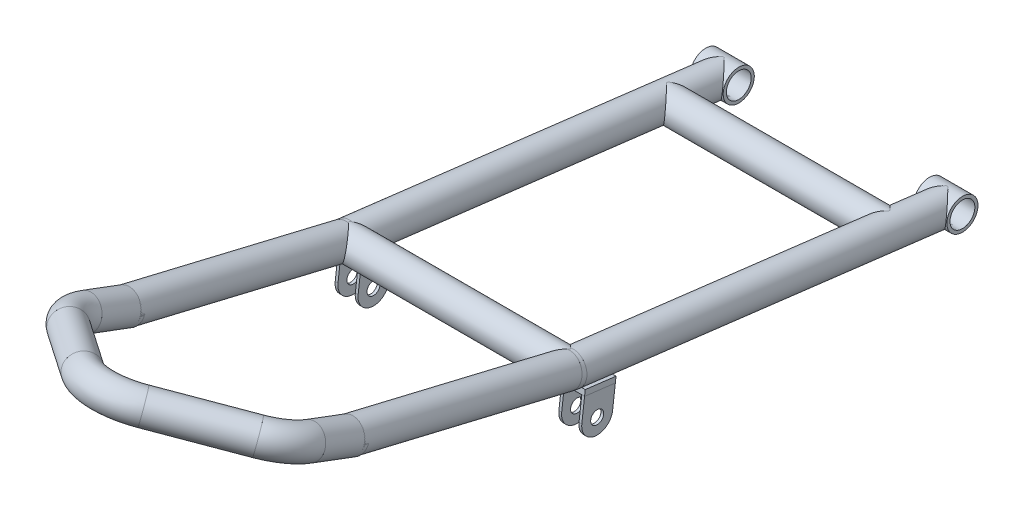
from build123d import *

# Parameters (mm, degrees)
CROQUIS2_R                       = 16.7
CROQUIS2_R_2                     = 13.32
SALIENTE_EXTRUIR3_DEPTH          = 17.7
MATRIZL2_COUNT                   = 2
MATRIZL2_PITCH                   = 240
SALIENTE_EXTRUIR5_DEPTH          = 24.6
SKETCH11_R                       = 16.7005
SKETCH11_R_2                     = 13.3223
MIEMBRO_ESTRUCTURAL3_DEPTH       = 240
SKETCH13_R                       = 16.7005
SKETCH13_R_2                     = 13.3223
MIEMBRO_ESTRUCTURAL5_DEPTH       = 240
SKETCH1_R                        = 16.7005
SKETCH1_R_2                      = 13.3223
MIEMBRO_ESTRUCTURAL8_DEPTH       = 240
SKETCH1_ON_SEGMENT_2_R           = 16.7005
SKETCH1_ON_SEGMENT_2_R_2         = 13.3223
MIEMBRO_ESTRUCTURAL8_2_DEPTH     = 405
SKETCH1_ON_SEGMENT_3_R           = 16.7005
SKETCH1_ON_SEGMENT_3_R_2         = 13.3223
MIEMBRO_ESTRUCTURAL8_3_DEPTH     = 50
SKETCH1_ON_SEGMENT_4_R           = 16.7005
SKETCH1_ON_SEGMENT_4_R_2         = 13.3223
MIEMBRO_ESTRUCTURAL8_4_ANGLE     = 50.254216628
SKETCH1_ON_SEGMENT_5_R           = 16.7005
SKETCH1_ON_SEGMENT_5_R_2         = 13.3223
MIEMBRO_ESTRUCTURAL8_5_DEPTH     = 90
SKETCH1_ON_SEGMENT_6_R           = 16.7005
SKETCH1_ON_SEGMENT_6_R_2         = 13.3223
MIEMBRO_ESTRUCTURAL8_6_ANGLE     = 79.491566745
SKETCH1_ON_SEGMENT_7_R           = 16.7005
SKETCH1_ON_SEGMENT_7_R_2         = 13.3223
MIEMBRO_ESTRUCTURAL8_7_DEPTH     = 90
SKETCH1_ON_SEGMENT_8_R           = 16.7005
SKETCH1_ON_SEGMENT_8_R_2         = 13.3223
MIEMBRO_ESTRUCTURAL8_8_ANGLE     = 50.254216628
SKETCH1_ON_SEGMENT_9_R           = 16.7005
SKETCH1_ON_SEGMENT_9_R_2         = 13.3223
MIEMBRO_ESTRUCTURAL8_9_DEPTH     = 50
MIEMBRO_ESTRUCTURAL9_OUTLINE_R   = 16.7005
MIEMBRO_ESTRUCTURAL9_OUTLINE_R_2 = 13.3223
MIEMBRO_ESTRUCTURAL9_ANGLE       = 6.420984
CORTAR_EXTRUIR1_START            = -310
CROQUIS25_R                      = 13.32
CORTAR_EXTRUIR1_DEPTH            = 310
CROQUIS10_R                      = 7
SALIENTE_EXTRUIR6_DEPTH          = 3


# Read off the part's stored shape, not the designer's step: Miembro estructural9
with BuildPart() as part:
    # Croquis2 → Saliente-Extruir3 (new, symmetric)
    with BuildSketch(Plane(origin=(120, 0, 0), x_dir=(0, 0, -1), z_dir=(1, 0, 0))):
        Circle(CROQUIS2_R)
        Circle(CROQUIS2_R_2, mode=Mode.SUBTRACT)
    saliente_extruir3 = extrude(amount=SALIENTE_EXTRUIR3_DEPTH, both=True)


with BuildPart() as matrizl2_1:
    # MatrizL2: Saliente-Extruir3 ×2
    with Locations(*[(-i * MATRIZL2_PITCH, 0, 0) for i in range(1, MATRIZL2_COUNT)]):
        add(saliente_extruir3)


with BuildPart() as body_3:
    # Croquis11 → Saliente-Extruir5 (new body)
    with BuildSketch(Plane(origin=(132.3, 0, 0), x_dir=(0, 0, -1), z_dir=(1, 0, 0))):
        Polygon((-400.007551389, 28.138933971), (-399.276335328, 34.094210881), (-366.25408611, 30.03958851), (-366.985302171, 24.084311601), align=None)
    extrude(amount=-SALIENTE_EXTRUIR5_DEPTH)


with BuildPart() as body_4:
    # Sketch11 → Miembro estructural3 (new body)
    with BuildSketch(Plane(origin=(120, 7.593004429, 61.840053094), x_dir=(0, 0.12186934340514761, 0.9925461516413221), z_dir=(-1.0, -5.447984185373814e-09, 6.689284625238227e-10))):
        Circle(SKETCH11_R)
        Circle(SKETCH11_R_2, mode=Mode.SUBTRACT)
    extrude(amount=MIEMBRO_ESTRUCTURAL3_DEPTH)


with BuildPart() as body_5:
    # Sketch13 → Miembro estructural5 (new body)
    with BuildSketch(Plane(origin=(-120, 49.704349846, 404.809444122), x_dir=(0, 0.2419218955996682, 0.9702957262759964), z_dir=(1, 0, 0))):
        Circle(SKETCH13_R)
        Circle(SKETCH13_R_2, mode=Mode.SUBTRACT)
    extrude(amount=MIEMBRO_ESTRUCTURAL5_DEPTH)


with BuildPart() as body_6:
    # Sketch1 → Miembro estructural8 (new body)
    with BuildSketch(Plane(origin=(120, 106.070724678, 641.026945046), x_dir=(0, 0.9726909395542314, -0.23210414927162898), z_dir=(0, -0.23210414927162898, -0.9726909395542314))):
        Circle(SKETCH1_R)
        Circle(SKETCH1_R_2, mode=Mode.SUBTRACT)
    extrude(amount=MIEMBRO_ESTRUCTURAL8_DEPTH)


with BuildPart() as body_7:
    # Sketch1 on segment 2 (carried to segment 2) → Miembro estructural8 2 (new body)
    with BuildSketch(Plane(origin=(120, 0, 0), x_dir=(0, -0.992546152, 0.121869343), z_dir=(0, 0.121869343, 0.992546152))):
        Circle(SKETCH1_ON_SEGMENT_2_R)
        Circle(SKETCH1_ON_SEGMENT_2_R_2, mode=Mode.SUBTRACT)
    extrude(amount=MIEMBRO_ESTRUCTURAL8_2_DEPTH)


with BuildPart() as body_8:
    # Sketch1 on segment 3 (carried to segment 3) → Miembro estructural8 3 (new body)
    with BuildSketch(Plane(origin=(120, 104.315510985, 636.348782464), x_dir=(0, -0.936269766, 0.35128183), z_dir=(0, 0.35128183, 0.936269766))):
        Circle(SKETCH1_ON_SEGMENT_3_R)
        Circle(SKETCH1_ON_SEGMENT_3_R_2, mode=Mode.SUBTRACT)
    extrude(amount=MIEMBRO_ESTRUCTURAL8_3_DEPTH)


with BuildPart() as body_9:
    # Sketch1 on segment 4 (carried to the start of arc 4) → Miembro estructural8 4 (revolve)
    with BuildSketch(Plane(origin=(120, 121.879602508, 683.162270787), x_dir=(0, -0.936269766, 0.35128183), z_dir=(0, 0.35128183, 0.936269766))):
        Circle(SKETCH1_ON_SEGMENT_4_R)
        Circle(SKETCH1_ON_SEGMENT_4_R_2, mode=Mode.SUBTRACT)
    revolve(axis=Axis((69.2, 121.879602508, 683.162270787), (0, -0.936269766, 0.35128183)), revolution_arc=MIEMBRO_ESTRUCTURAL8_4_ANGLE)


with BuildPart() as body_10:
    # Sketch1 on segment 5 (carried to segment 5) → Miembro estructural8 5 (new body)
    with BuildSketch(Plane(origin=(101.680626838, 135.600514681, 719.732551745), x_dir=(0.167254421, 0.974322553, -0.150736599), z_dir=(-0.768888889, 0.224603426, 0.598634427))):
        Circle(SKETCH1_ON_SEGMENT_5_R)
        Circle(SKETCH1_ON_SEGMENT_5_R_2, mode=Mode.SUBTRACT)
    extrude(amount=MIEMBRO_ESTRUCTURAL8_5_DEPTH)


with BuildPart() as body_11:
    # Sketch1 on segment 6 (carried to the start of arc 6) → Miembro estructural8 6 (revolve)
    with BuildSketch(Plane(origin=(32.480626838, 155.814823038, 773.609650197), x_dir=(0.167254421, 0.974322553, -0.150736599), z_dir=(-0.768888889, 0.224603426, 0.598634427))):
        Circle(SKETCH1_ON_SEGMENT_6_R)
        Circle(SKETCH1_ON_SEGMENT_6_R_2, mode=Mode.SUBTRACT)
    revolve(axis=Axis((0, 142.093910865, 737.039369239), (0, -0.936269766, 0.35128183)), revolution_arc=MIEMBRO_ESTRUCTURAL8_6_ANGLE)


with BuildPart() as body_12:
    # Sketch1 on segment 7 (carried to segment 7) → Miembro estructural8 7 (new body)
    with BuildSketch(Plane(origin=(-32.480626838, 155.814823038, 773.609650197), x_dir=(-0.037411038, 0.950469388, -0.308558515), z_dir=(-0.768888889, -0.224603426, -0.598634427))):
        Circle(SKETCH1_ON_SEGMENT_7_R)
        Circle(SKETCH1_ON_SEGMENT_7_R_2, mode=Mode.SUBTRACT)
    extrude(amount=MIEMBRO_ESTRUCTURAL8_7_DEPTH)


with BuildPart() as body_13:
    # Sketch1 on segment 8 (carried to the start of arc 8) → Miembro estructural8 8 (revolve)
    with BuildSketch(Plane(origin=(-101.680626838, 135.600514681, 719.732551745), x_dir=(-0.037411038, 0.950469388, -0.308558515), z_dir=(-0.768888889, -0.224603426, -0.598634427))):
        Circle(SKETCH1_ON_SEGMENT_8_R)
        Circle(SKETCH1_ON_SEGMENT_8_R_2, mode=Mode.SUBTRACT)
    revolve(axis=Axis((-69.2, 121.879602508, 683.162270787), (0, -0.936269766, 0.35128183)), revolution_arc=MIEMBRO_ESTRUCTURAL8_8_ANGLE)


with BuildPart() as body_14:
    # Sketch1 on segment 9 (carried to segment 9) → Miembro estructural8 9 (new body)
    with BuildSketch(Plane(origin=(-120, 121.879602508, 683.162270787), x_dir=(0, 0.936269766, -0.35128183), z_dir=(0, -0.35128183, -0.936269766))):
        Circle(SKETCH1_ON_SEGMENT_9_R)
        Circle(SKETCH1_ON_SEGMENT_9_R_2, mode=Mode.SUBTRACT)
    extrude(amount=MIEMBRO_ESTRUCTURAL8_9_DEPTH)


with BuildPart() as body_15:
    # Miembro estructural9 outline → Miembro estructural9 (revolve)
    with BuildSketch(Plane(origin=(0, 99.778428582, 395.79022877), x_dir=(0, -0.9726909395542299, 0.23210414927163517), z_dir=(0, 0.23210414927163517, 0.9726909395542299))):
        with Locations((50.8, 120)):
            Circle(MIEMBRO_ESTRUCTURAL9_OUTLINE_R)
        with Locations((50.8, 120)):
            Circle(MIEMBRO_ESTRUCTURAL9_OUTLINE_R_2, mode=Mode.SUBTRACT)
    revolve(axis=Axis((0, 99.778428582, 395.79022877), (1, 0, 0)), revolution_arc=MIEMBRO_ESTRUCTURAL9_ANGLE)


with BuildPart() as body_16:
    # Simetría1: mirrored copy
    add(body_6.part.mirror(Plane(origin=(0, 0, 0), x_dir=(0, 0, 1), z_dir=(1, 0, 0))))


with BuildPart() as body_17:
    # Simetr_a1 2: mirrored copy
    add(body_15.part.mirror(Plane(origin=(0, 0, 0), x_dir=(0, 0, 1), z_dir=(1, 0, 0))))


with BuildPart() as body_18:
    # Simetr_a1 3: mirrored copy
    add(body_7.part.mirror(Plane(origin=(0, 0, 0), x_dir=(0, 0, 1), z_dir=(1, 0, 0))))


with BuildPart() as cortar_extruir1_tool:
    # Croquis25 → Cortar-Extruir1 (new body)
    with BuildSketch(Plane(origin=(137.7, 0, 0), x_dir=(0, 0, -1), z_dir=(1, 0, 0)).offset(CORTAR_EXTRUIR1_START)):
        Circle(CROQUIS25_R)
    extrude(amount=CORTAR_EXTRUIR1_DEPTH)


with BuildPart() as body_7_1:
    add(body_7.part)

    # Cortar-Extruir1: cut by cortar_extruir1_tool
    add(cortar_extruir1_tool.part, mode=Mode.SUBTRACT)


with BuildPart() as body_18_1:
    add(body_18.part)

    # Cortar-Extruir1: cut by cortar_extruir1_tool
    add(cortar_extruir1_tool.part, mode=Mode.SUBTRACT)


with BuildPart() as body_19:
    # Croquis10 → Saliente-Extruir6 (new body)
    with BuildSketch(Plane(origin=(132.3, 0, 0), x_dir=(0, 0, -1), z_dir=(1, 0, 0))):
        with BuildLine():
            Line((-402.97625837, 4.05462237), (-400.007551389, 28.138933971))
            Line((-400.007551389, 28.138933971), (-366.985302171, 24.084311601))
            Line((-366.985302171, 24.084311601), (-369.955927869, -0.015566029))
            ThreePointArc((-369.955927869, -0.015566029), (-388.501184102, -14.490641201), (-402.97625837, 4.05462237))
        make_face()
        with Locations((-386.46608945, 2.019527719)):
            Circle(CROQUIS10_R, mode=Mode.SUBTRACT)
    extrude(amount=-SALIENTE_EXTRUIR6_DEPTH)


with BuildPart() as body_20:
    # Simetría2: mirrored copy
    add(body_19.part.mirror(Plane(origin=(120, 0, 0), x_dir=(0, 0, 1), z_dir=(1, 0, 0))))


with BuildPart() as body_21:
    # Simetría3: mirrored copy
    add(body_19.part.mirror(Plane(origin=(0, 0, 0), x_dir=(0, 0, 1), z_dir=(1, 0, 0))))


with BuildPart() as body_22:
    # Simetr_a3 2: mirrored copy
    add(body_3.part.mirror(Plane(origin=(0, 0, 0), x_dir=(0, 0, 1), z_dir=(1, 0, 0))))


with BuildPart() as body_23:
    # Simetr_a3 3: mirrored copy
    add(body_20.part.mirror(Plane(origin=(0, 0, 0), x_dir=(0, 0, 1), z_dir=(1, 0, 0))))


solid = Compound([part.part, matrizl2_1.part, body_3.part, body_4.part, body_5.part, body_6.part, body_8.part, body_9.part, body_10.part, body_11.part, body_12.part, body_13.part, body_14.part, body_15.part, body_16.part, body_17.part, body_7_1.part, body_18_1.part, body_19.part, body_20.part, body_21.part, body_22.part, body_23.part])
